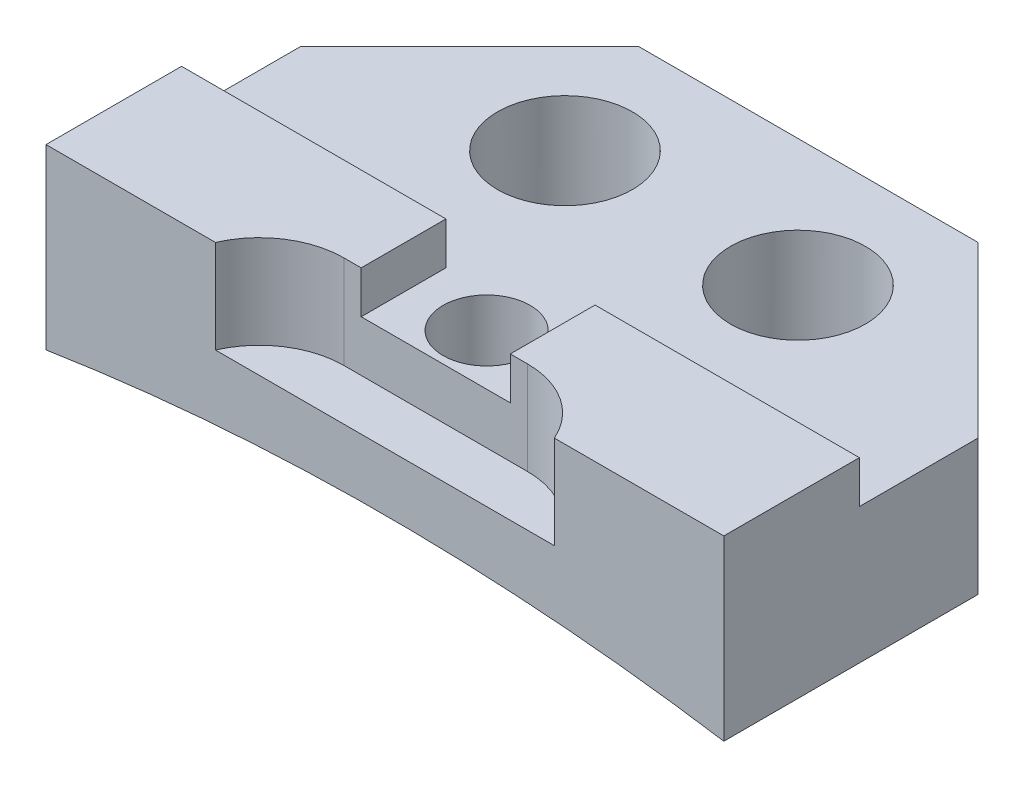
from build123d import *

# Parameters (mm, degrees)
BOSS_EXTRUDE1_DEPTH        = 3.175
CUT_EXTRUDE1_DEPTH         = 30.765898876
CUT_EXTRUDE1_DEPTH_BACK    = 30.765898876
SKETCH2_R                  = 83.82
BOSS_EXTRUDE2_DEPTH        = 15.875
CHAMFER1_SIZE              = 6.35
F_8_0_199_DIAMETER_HOLE1_D = 5.0546
CUT_EXTRUDE3_DEPTH         = 1.905
SKETCH6_R                  = 1.63195
CUT_EXTRUDE2_DEPTH         = 36.477207644
BOSS_EXTRUDE3_START        = 1.5875
BOSS_EXTRUDE3_DEPTH        = 1.5875


with BuildPart() as part:
    # Sketch1 → Boss-Extrude1 (new body)
    with BuildSketch(Plane(origin=(0, 0, 0), x_dir=(1, 0, 0), z_dir=(0, 1, 0))):
        Polygon((-28.511825699, -10.967228887), (-22.161825699, -4.617228887), (-9.461825699, -4.617228887), (-3.111825699, -10.967228887), (-3.111825699, -12.554728887), (-28.511825699, -12.554728887), align=None)
    extrude(amount=BOSS_EXTRUDE1_DEPTH)

    # Sketch2 → Cut-Extrude1 (cut, two sides: drawn at the far end of the back side and taken through both)
    with BuildSketch(Plane.XY.offset(12.554728887).offset(-CUT_EXTRUDE1_DEPTH_BACK)):
        with Locations((-15.811825699, -82.852292666)):
            Circle(SKETCH2_R)
    extrude(amount=CUT_EXTRUDE1_DEPTH + CUT_EXTRUDE1_DEPTH_BACK, mode=Mode.SUBTRACT)

    # Sketch5 → Boss-Extrude2 (add)
    with BuildSketch(Plane(origin=(0, 0, 4.617228887), x_dir=(-1, 0, 0), z_dir=(0, 0, -1))):
        with BuildLine():
            Line((3.111825699, 3.175), (3.111825699, 0))
            Line((3.111825699, 0), (3.111825699, -1.902066279))
            ThreePointArc((3.111825699, -1.902066279), (15.811825699, -0.911892666), (28.511825699, -1.902066279))
            Line((28.511825699, -1.902066279), (28.511825699, 0))
            Line((28.511825699, 0), (28.511825699, 3.175))
            Line((28.511825699, 3.175), (3.111825699, 3.175))
        make_face()
    extrude(amount=-BOSS_EXTRUDE2_DEPTH)

    # Chamfer1
    chamfer1_edges = [part.edges().sort_by_distance(p)[0] for p in [
        (-28.511825699, 0.636466861, 4.617228887),
        (-3.111825699, 0.636466861, 4.617228887),
    ]]
    chamfer(chamfer1_edges, length=CHAMFER1_SIZE)

    # #8 (0.199) Diameter Hole1 (through all)
    with Locations(Plane(origin=(0, 3.175, 0), x_dir=(1, 0, 0), z_dir=(0, 1, 0))):
        with Locations((-20.177450699, -9.379728887), (-11.446200699, -9.379728887)):
            Hole(F_8_0_199_DIAMETER_HOLE1_D / 2)

    # Sketch8 → Cut-Extrude3 (cut)
    with BuildSketch(Plane(origin=(0, 3.175, 0), x_dir=(1, 0, 0), z_dir=(0, 1, 0))):
        with BuildLine():
            Line((-22.161825699, -20.492228887), (-9.461825699, -20.492228887))
            ThreePointArc((-9.461825699, -20.492228887), (-10.632742145, -19.105833302), (-12.371761265, -18.587228887))
            Line((-12.371761265, -18.587228887), (-19.251890132, -18.587228887))
            ThreePointArc((-19.251890132, -18.587228887), (-20.990909252, -19.105833302), (-22.161825699, -20.492228887))
        make_face()
    extrude(amount=-CUT_EXTRUDE3_DEPTH, mode=Mode.SUBTRACT)

    # Sketch6 → Cut-Extrude2 (cut, through all)
    with BuildSketch(Plane(origin=(0, 3.175, 0), x_dir=(1, 0, 0), z_dir=(0, 1, 0))):
        with Locations((-15.81004542, -16.682228887)):
            Circle(SKETCH6_R)
    extrude(amount=-CUT_EXTRUDE2_DEPTH, mode=Mode.SUBTRACT)

    # Sketch7 → Boss-Extrude3 (add)
    with BuildSketch(Plane(origin=(0, 3.175, 0), x_dir=(1, 0, 0), z_dir=(0, 1, 0)).offset(BOSS_EXTRUDE3_START)):
        with BuildLine():
            Line((-28.511825699, -15.412228887), (-18.605825699, -15.412228887))
            Line((-18.605825699, -15.412228887), (-18.605825699, -18.587228887))
            Line((-18.605825699, -18.587228887), (-19.251890132, -18.587228887))
            ThreePointArc((-19.251890132, -18.587228887), (-20.990909252, -19.105833302), (-22.161825699, -20.492228887))
            Line((-22.161825699, -20.492228887), (-28.511825699, -20.492228887))
            Line((-28.511825699, -20.492228887), (-28.511825699, -15.412228887))
        make_face()
        with BuildLine():
            Line((-13.017825699, -15.412228887), (-13.017825699, -18.587228887))
            Line((-13.017825699, -18.587228887), (-12.371761265, -18.587228887))
            ThreePointArc((-12.371761265, -18.587228887), (-10.632742145, -19.105833302), (-9.461825699, -20.492228887))
            Line((-9.461825699, -20.492228887), (-3.111825699, -20.492228887))
            Line((-3.111825699, -20.492228887), (-3.111825699, -15.412228887))
            Line((-3.111825699, -15.412228887), (-13.017825699, -15.412228887))
        make_face()
    extrude(amount=-BOSS_EXTRUDE3_DEPTH)


solid = part.part
